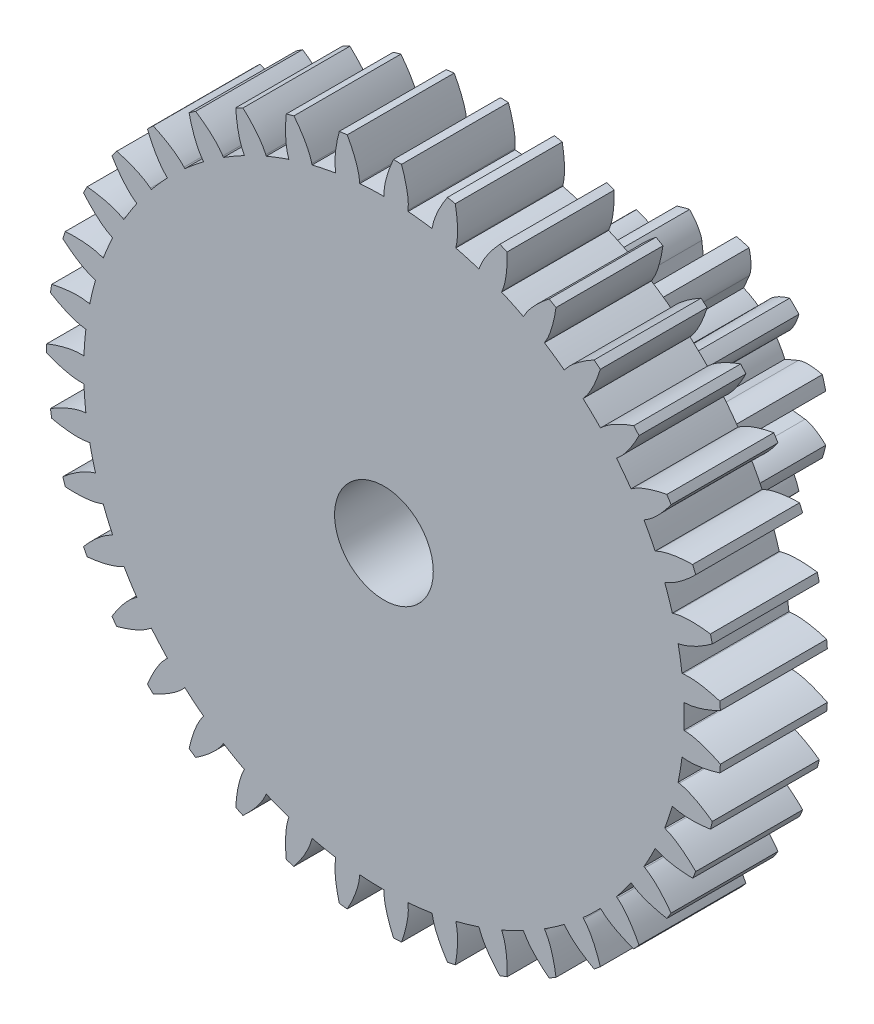
from build123d import *

# Parameters (mm, degrees)
SKETCH_1_R               = 1.4
SKETCH_1_R_2             = 0.6
EXTRUDE_1_DEPTH          = 2.7
CUT_EXTRUDE_1_DEPTH      = 4.348133809
PATTERN_CIRCULAR_1_COUNT = 12
PATTERN_CIRCULAR_1_ANGLE = 330
SKETCH_2_R               = 4.1
SKETCH_2_R_2             = 0.6
EXTRUDE_2_DEPTH          = 1.3
CUT_EXTRUDE_3_DEPTH      = 7.396092728
PATTERN_CIRCULAR_2_COUNT = 39


with BuildPart() as part:
    # 草图1 → 凸台-拉伸1 (new body)
    with BuildSketch(Plane.XY):
        Circle(SKETCH_1_R)
        Circle(SKETCH_1_R_2, mode=Mode.SUBTRACT)
    extrude(amount=EXTRUDE_1_DEPTH)

    # 草图1<3> → 切除-拉伸1 (cut, through all)
    with BuildSketch(Plane.XY):
        with BuildLine():
            Line((1.11946981, 0.135422832), (0.943124287, 0.114090224))
            ThreePointArc((0.943124287, 0.114090224), (0.948279514, 0.057148611), (0.95, 0))
            ThreePointArc((0.95, 0), (0.948279514, -0.057148611), (0.943124287, -0.114090224))
            Line((0.943124287, -0.114090224), (1.11946981, -0.135422832))
            add(Edge.make_bspline(
                [(1.11946981, -0.135422832), (1.128003225, -0.136455124), (1.151602744, -0.141109468), (1.194919759, -0.156967361), (1.260546906, -0.191853213), (1.313246813, -0.231377006), (1.350571488, -0.264875278), (1.370742128, -0.284720947)],
                knots=[0, 0, 0, 0, 0, 0.005604068, 0.015718248, 0.029959916, 0.048452588, 0.048452588, 0.048452588, 0.048452588, 0.048452588], degree=4))
            ThreePointArc((1.370742128, -0.284720947), (1.392666324, -0.143110133), (1.4, 0))
            ThreePointArc((1.4, 0), (1.392666324, 0.143110133), (1.370742128, 0.284720947))
            add(Edge.make_bspline(
                [(1.11946981, 0.135422832), (1.128003225, 0.136455124), (1.151602744, 0.141109468), (1.194919759, 0.156967361), (1.260546906, 0.191853213), (1.313246813, 0.231377006), (1.350571488, 0.264875278), (1.370742128, 0.284720947)],
                knots=[0, 0, 0, 0, 0, 0.005604068, 0.015718248, 0.029959916, 0.048452588, 0.048452588, 0.048452588, 0.048452588, 0.048452588], degree=4))
        make_face()
    cut_extrude_1 = extrude(amount=CUT_EXTRUDE_1_DEPTH, mode=Mode.SUBTRACT)

    # 阵列(圆周)1: 切除-拉伸1 ×12 about axis
    pattern_circular_1_axis = Axis((0, 0, 2.7), (0, 0, 1))
    for i in range(1, PATTERN_CIRCULAR_1_COUNT):
        add(cut_extrude_1.rotate(pattern_circular_1_axis, i * PATTERN_CIRCULAR_1_ANGLE / (PATTERN_CIRCULAR_1_COUNT - 1)), mode=Mode.SUBTRACT)

    # 草图2 → 凸台-拉伸2 (add)
    with BuildSketch(Plane.XY.offset(2.7)):
        Circle(SKETCH_2_R)
        Circle(SKETCH_2_R_2, mode=Mode.SUBTRACT)
    extrude(amount=EXTRUDE_2_DEPTH)

    # 草图2<3> → 切除-拉伸3 (cut, through all)
    with BuildSketch(Plane.XY.offset(2.7)):
        with BuildLine():
            Line((3.661829061, 0.147566666), (3.647039843, 0.146970681))
            ThreePointArc((3.647039843, 0.146970681), (3.649259886, 0.073500244), (3.65, 0))
            ThreePointArc((3.65, 0), (3.649259886, -0.073500244), (3.647039843, -0.146970681))
            Line((3.647039843, -0.146970681), (3.661829061, -0.147566666))
            add(Edge.make_bspline(
                [(3.661829061, -0.147566666), (3.689742193, -0.148691527), (3.767404776, -0.157632004), (3.876970726, -0.188052536), (3.98228792, -0.229530511), (4.059229674, -0.265952442), (4.090314081, -0.281657101)],
                knots=[0, 0, 0, 0, 0, 0.005604068, 0.015718248, 0.022724036, 0.022724036, 0.022724036, 0.022724036, 0.022724036], degree=4))
            ThreePointArc((4.090314081, -0.281657101), (4.097577805, -0.140911798), (4.1, 0))
            ThreePointArc((4.1, 0), (4.097577805, 0.140911798), (4.090314081, 0.281657101))
            add(Edge.make_bspline(
                [(3.661829061, 0.147566666), (3.689742193, 0.148691527), (3.767404776, 0.157632004), (3.876970726, 0.188052536), (3.98228792, 0.229530511), (4.059229674, 0.265952442), (4.090314081, 0.281657101)],
                knots=[0, 0, 0, 0, 0, 0.005604068, 0.015718248, 0.022724036, 0.022724036, 0.022724036, 0.022724036, 0.022724036], degree=4))
        make_face()
    cut_extrude_3 = extrude(amount=CUT_EXTRUDE_3_DEPTH, mode=Mode.SUBTRACT)

    # 阵列(圆周)2: 切除-拉伸3 ×39 about axis
    pattern_circular_2_axis = Axis((0, 0, 4), (0, 0, 1))
    for i in range(1, PATTERN_CIRCULAR_2_COUNT):
        add(cut_extrude_3.rotate(pattern_circular_2_axis, i * 360 / PATTERN_CIRCULAR_2_COUNT), mode=Mode.SUBTRACT)


solid = part.part
